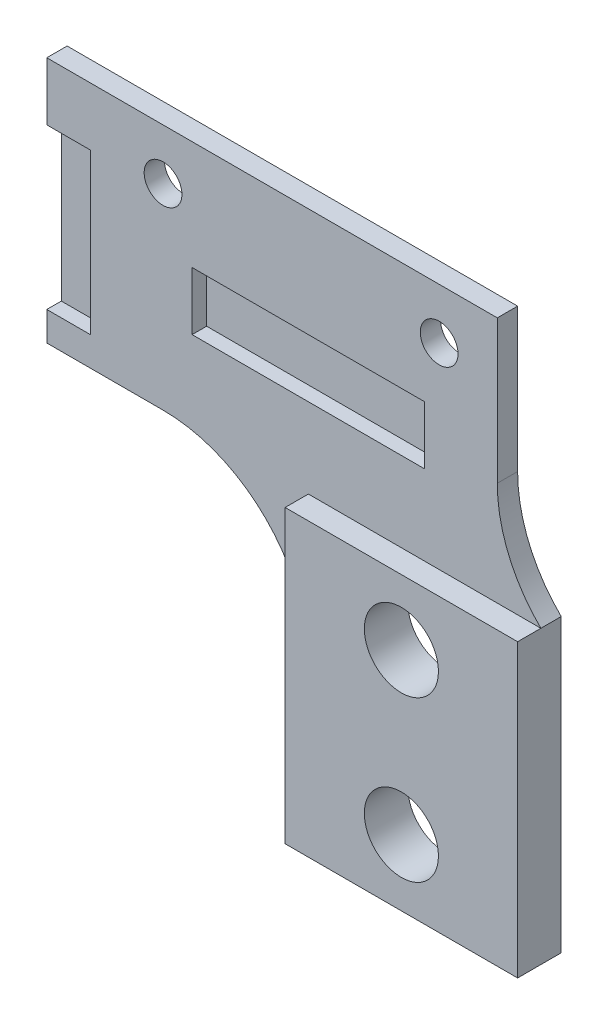
from build123d import *

# Parameters (mm, degrees)
SKETCH1_W           = 40
SKETCH1_H           = 17
BOSS_EXTRUDE1_DEPTH = 1.4
CUT_EXTRUDE1_START  = 1.4
SKETCH3_W           = 16
SKETCH3_H           = 4
SKETCH3_W_2         = 3
SKETCH3_H_2         = 11
CUT_EXTRUDE1_DEPTH  = 1
SKETCH4_R           = 1.3
CUT_EXTRUDE2_DEPTH  = 11
SKETCH7_W           = 9
SKETCH7_H           = 17
CUT_EXTRUDE5_DEPTH  = 21
SKETCH9_W           = 16
SKETCH9_H           = 20.041444064
SKETCH9_R           = 2.55
BOSS_EXTRUDE3_DEPTH = 3
FILLET1_R           = 10


with BuildPart() as part:
    # Sketch1 → Boss-Extrude1 (new body)
    with BuildSketch(Plane.XY):
        Rectangle(SKETCH1_W, SKETCH1_H)
    extrude(amount=BOSS_EXTRUDE1_DEPTH)

    # Sketch3 → Cut-Extrude1 (cut)
    with BuildSketch(Plane.XY.offset(CUT_EXTRUDE1_START)):
        with Locations((7, -1)):
            Rectangle(SKETCH3_W, SKETCH3_H)
        with Locations((-9.5, -1)):
            Rectangle(SKETCH3_W_2, SKETCH3_H_2)
    extrude(amount=-CUT_EXTRUDE1_DEPTH, mode=Mode.SUBTRACT)

    # Sketch4 → Cut-Extrude2 (cut)
    with BuildSketch(Plane.XY):
        with Locations(Location((16, 5, 0), (0, 0, 180))):
            Circle(SKETCH4_R)
        with Locations(Location((-3, 5, 0), (0, 0, 180))):
            Circle(SKETCH4_R)
    extrude(amount=CUT_EXTRUDE2_DEPTH, mode=Mode.SUBTRACT)

    # Sketch7 → Cut-Extrude5 (cut)
    with BuildSketch(Plane.XY):
        with Locations((-15.5, 0)):
            Rectangle(SKETCH7_W, SKETCH7_H)
    extrude(amount=CUT_EXTRUDE5_DEPTH, mode=Mode.SUBTRACT)

    # Sketch9 → Boss-Extrude3 (add)
    with BuildSketch(Plane.XY):
        with Locations((15, -18.520722032)):
            Rectangle(SKETCH9_W, SKETCH9_H)
        with Locations((15, -13)):
            Circle(SKETCH9_R, mode=Mode.SUBTRACT)
        with Locations((15, -24)):
            Circle(SKETCH9_R, mode=Mode.SUBTRACT)
    extrude(amount=BOSS_EXTRUDE3_DEPTH)

    # Fillet1
    # the kernel refuses this fillet: 10 mm, written as the material it adds along each edge
    with BuildSketch(Plane(origin=(7, -8.5, 0), x_dir=(-1, 0, 0), z_dir=(0, 0, 1))) as fillet1_piece_1:
        with BuildLine():
            CenterArc((FILLET1_R, FILLET1_R), FILLET1_R, 180, 90)
            Line((0, FILLET1_R), (0, 0))
            Line((0, 0), (FILLET1_R, 0))
        make_face()
    extrude(amount=1.4)
    with BuildSketch(Plane(origin=(20, -8.5, 0), x_dir=(0, 1, 0), z_dir=(0, 0, 1))) as fillet1_piece_2:
        with BuildLine():
            CenterArc((7.141428429, -10), FILLET1_R, 90, 45.572995999)
            Line((0, -3), (0, 0))
            Line((0, 0), (7.141428429, 0))
        make_face()
    extrude(amount=1.4)


solid = part.part
